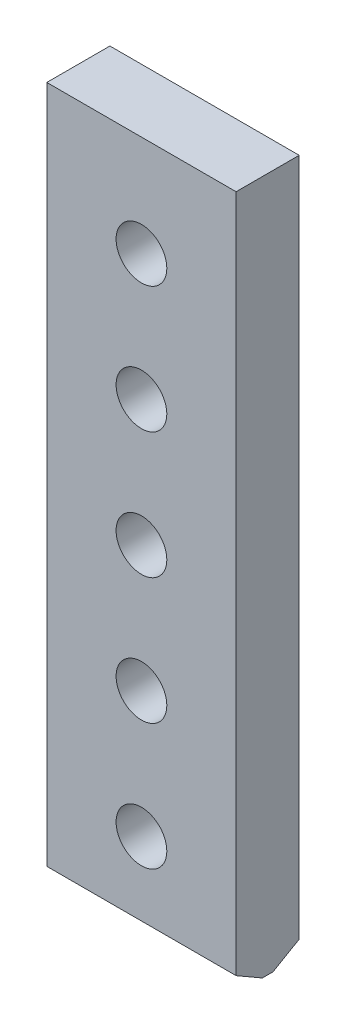
from build123d import *

# Parameters (mm, degrees)
SKETCH_1_W          = 75
SKETCH_1_H          = 275
EXTRUDE_1_DEPTH     = 25
SKETCH_2_R          = 10.05
CUT_EXTRUDE_1_DEPTH = 287.138078556
CHAMFER_1_SIZE      = 6
CHAMFER_1_SIZE2     = 10.392304845
CHAMFER_2_SIZE      = 6
CHAMFER_2_SIZE2     = 10.392304845


with BuildPart() as part:
    # Эскиз1 → Бобышка-Вытянуть1 (new body)
    with BuildSketch(Plane.XY):
        with Locations((37.5, 137.5)):
            Rectangle(SKETCH_1_W, SKETCH_1_H)
    extrude(amount=EXTRUDE_1_DEPTH)

    # Эскиз2 → Вырез-Вытянуть1 (cut, through all)
    with BuildSketch(Plane.XY.offset(25)):
        with Locations((37.5, 35)):
            Circle(SKETCH_2_R)
        with Locations((37.5, 85)):
            Circle(SKETCH_2_R)
        with Locations((37.5, 135)):
            Circle(SKETCH_2_R)
        with Locations((37.5, 185)):
            Circle(SKETCH_2_R)
        with Locations((37.5, 235)):
            Circle(SKETCH_2_R)
    extrude(amount=-CUT_EXTRUDE_1_DEPTH, mode=Mode.SUBTRACT)

    # Фаска1
    chamfer_1_edges = [part.edges().sort_by_distance(p)[0] for p in [
        (37.5, 0, 0),
    ]]
    chamfer_1_side = [part.faces().sort_by_distance(p)[0] for p in [
        (37.5, 2.850438563, 0),
    ]]
    chamfer(chamfer_1_edges, length=CHAMFER_1_SIZE, length2=CHAMFER_1_SIZE2, reference=chamfer_1_side[0])

    # Фаска2
    chamfer_2_edges = [part.edges().sort_by_distance(p)[0] for p in [
        (37.5, 0, 25),
    ]]
    chamfer_2_side = [part.faces().sort_by_distance(p)[0] for p in [
        (37.5, 2.850438563, 25),
    ]]
    chamfer(chamfer_2_edges, length=CHAMFER_2_SIZE, length2=CHAMFER_2_SIZE2, reference=chamfer_2_side[0])


solid = part.part
